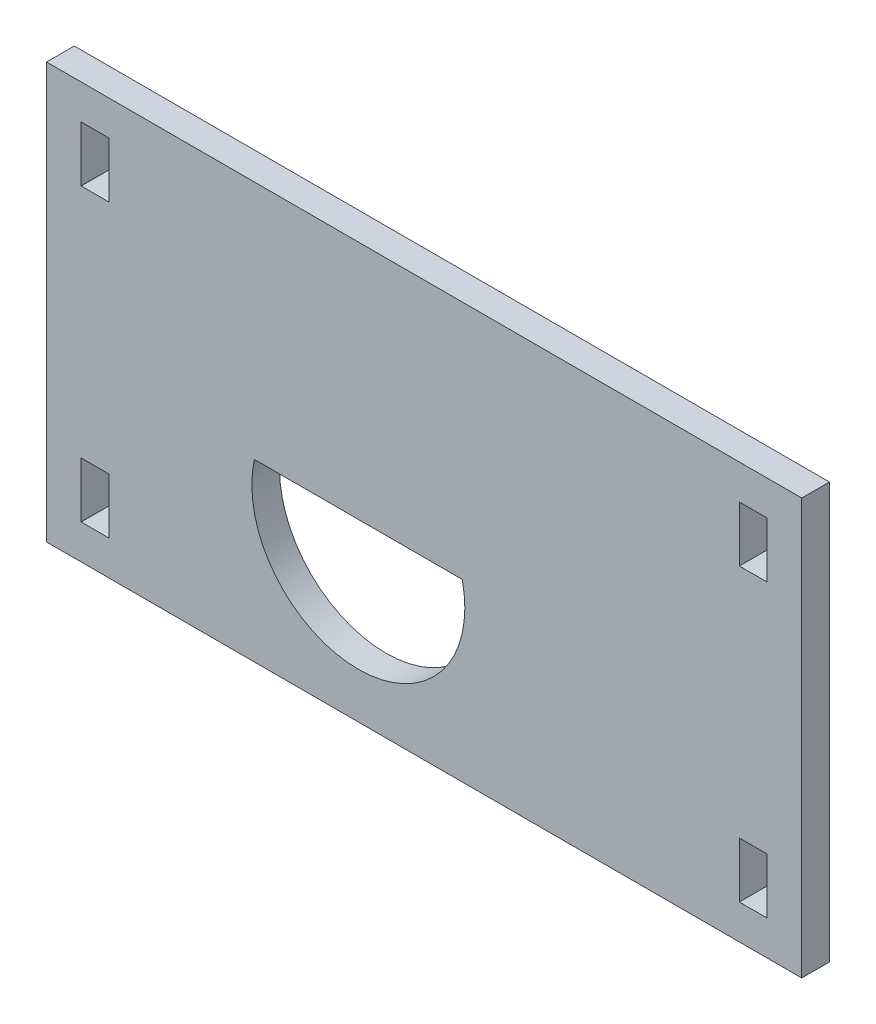
from build123d import *

# Parameters (mm, degrees)
SKETCH1_W           = 4
SKETCH1_H           = 8
BOSS_EXTRUDE1_DEPTH = 4


with BuildPart() as part:
    # Sketch1 → Boss-Extrude1 (new body)
    with BuildSketch(Plane.XY):
        Polygon((-45, -30), (55, -30), (64, -30), (64, 30), (55, 30), (-45, 30), align=None)
        with BuildLine():
            Line((-15, -4.678634488), (15, -4.678634488))
            ThreePointArc((15, -4.678634488), (0, -23.408168987), (-15, -4.678634488))
        make_face(mode=Mode.SUBTRACT)
        with Locations((-38, -21)):
            Rectangle(SKETCH1_W, SKETCH1_H, mode=Mode.SUBTRACT)
        with Locations((-38, 21)):
            Rectangle(SKETCH1_W, SKETCH1_H, mode=Mode.SUBTRACT)
        with Locations((57, 21)):
            Rectangle(SKETCH1_W, SKETCH1_H, mode=Mode.SUBTRACT)
        with Locations((57, -21)):
            Rectangle(SKETCH1_W, SKETCH1_H, mode=Mode.SUBTRACT)
    extrude(amount=BOSS_EXTRUDE1_DEPTH)


solid = part.part
